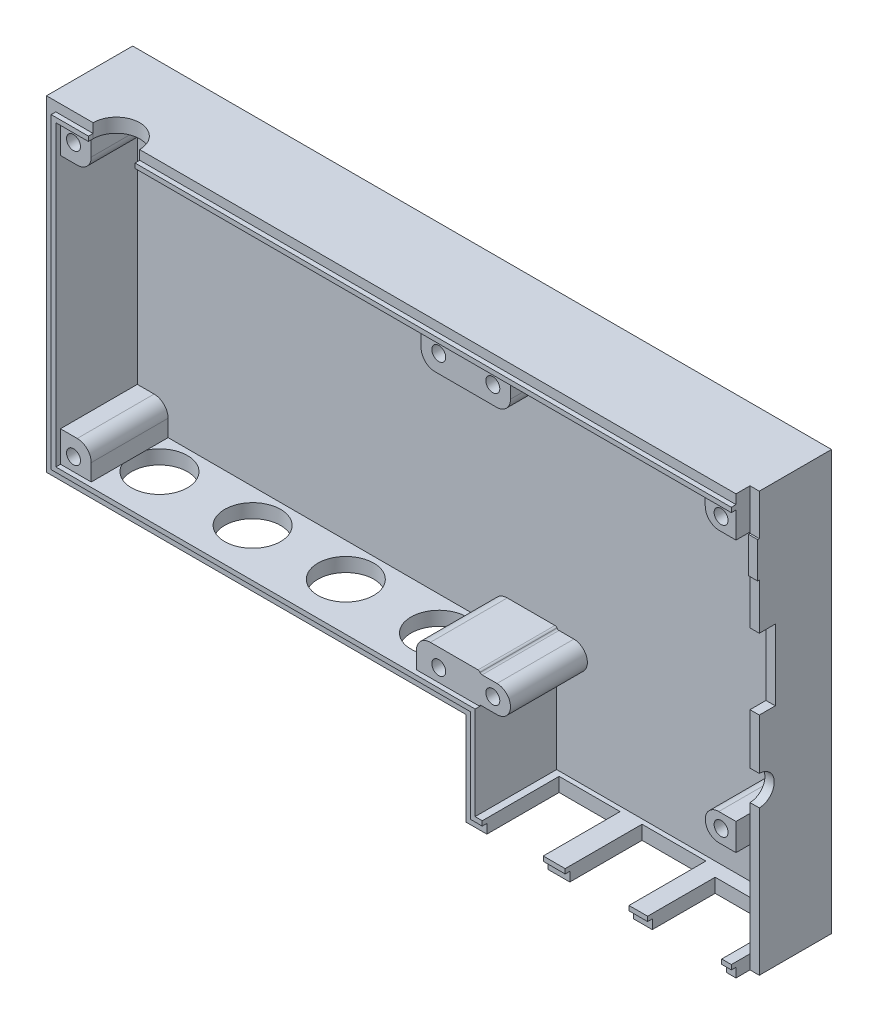
from build123d import *

# Parameters (mm, degrees)
SKETCH1_W                      = 60
SKETCH1_H                      = 90
SKETCH1_R                      = 1.5
BOSS_EXTRUDE1_DEPTH            = 1
BOSS_EXTRUDE2_DEPTH            = 16.5
SKETCH3_W                      = 2
SKETCH3_H                      = 90
BOSS_EXTRUDE3_DEPTH            = 13.5
BOSS_EXTRUDE4_DEPTH            = 1
SKETCH5_W                      = 13.1
SKETCH5_H                      = 3
SKETCH5_W_2                    = 13.7
CUT_EXTRUDE1_DEPTH             = 16.5
SKETCH6_W                      = 15.9
SKETCH6_H                      = 3
CUT_EXTRUDE2_DEPTH             = 14.5
SKETCH7_R                      = 1.5
SKETCH7_W                      = 6.6
SKETCH7_H                      = 6.6
SKETCH7_H_2                    = 5.6
BOSS_EXTRUDE5_DEPTH            = 16.5
FILLET3_R                      = 3
CUT_EXTRUDE3_DEPTH             = 78.24797732
CUT_EXTRUDE3_DEPTH_BACK        = 2
SKETCH10_W                     = 2
SKETCH10_H                     = 15.2
CUT_EXTRUDE4_DEPTH             = 3.43
SKETCH11_W                     = 2
SKETCH11_H                     = 7.7
BOSS_EXTRUDE6_DEPTH            = 0.35
SKETCH13_W                     = 90
SKETCH13_H                     = 70
BOSS_EXTRUDE7_DEPTH            = 2
SKETCH14_W                     = 90
SKETCH14_H                     = 70
SKETCH14_W_2                   = 84
SKETCH14_H_2                   = 64
BOSS_EXTRUDE8_DEPTH            = 16.5
SKETCH15_W                     = 86
SKETCH15_H                     = 66
SKETCH15_W_2                   = 84
SKETCH15_H_2                   = 64
SKETCH15_W_3                   = 4
SKETCH15_H_3                   = 1
BOSS_EXTRUDE9_DEPTH            = 1
SKETCH16_W                     = 6
SKETCH16_H                     = 64
CUT_EXTRUDE6_DEPTH             = 1
CUT_EXTRUDE7_REACH             = 142.151
SKETCH17_R                     = 6
CUT_EXTRUDE7_DIRECTION_2_DEPTH = 141.150811628
BOSS_EXTRUDE10_DEPTH           = 16.5
CUT_EXTRUDE8_DEPTH             = 56
CUT_EXTRUDE8_DEPTH_BACK        = 19
SKETCH18_R                     = 1.5
SKETCH20_W                     = 6
SKETCH20_H                     = 50.8
CUT_EXTRUDE9_DEPTH             = 16.5
FILLET4_R                      = 0.5
FILLET5_R                      = 0.5
CUT_EXTRUDE10_DEPTH            = 4


with BuildPart() as part:
    # Sketch1 → Boss-Extrude1 (new, symmetric)
    with BuildSketch(Plane.XY):
        Rectangle(SKETCH1_W, SKETCH1_H)
        with Locations((-24.2, -18.8)):
            Circle(SKETCH1_R, mode=Mode.SUBTRACT)
        with Locations((-24.2, 39.2)):
            Circle(SKETCH1_R, mode=Mode.SUBTRACT)
        with Locations((24.8, 39.2)):
            Circle(SKETCH1_R, mode=Mode.SUBTRACT)
        with Locations((24.8, -18.8)):
            Circle(SKETCH1_R, mode=Mode.SUBTRACT)
    extrude(amount=BOSS_EXTRUDE1_DEPTH, both=True)

    # Sketch2 → Boss-Extrude2 (add)
    with BuildSketch(Plane.XY.offset(1)):
        Polygon((-27, 42), (28, 42), (28, 45), (-30, 45), (-30, -45), (28, -45), (28, -42), (-27, -42), align=None)
    extrude(amount=BOSS_EXTRUDE2_DEPTH)

    # Sketch3 → Boss-Extrude3 (add)
    with BuildSketch(Plane.XY.offset(1)):
        with Locations((29, 0)):
            Rectangle(SKETCH3_W, SKETCH3_H)
    extrude(amount=BOSS_EXTRUDE3_DEPTH)

    # Sketch4 → Boss-Extrude4 (add)
    with BuildSketch(Plane.XY.offset(17.5)):
        Polygon((28, -43), (-28, -43), (-28, 43), (28, 43), (28, 42), (-27, 42), (-27, -42), (28, -42), align=None)
    extrude(amount=BOSS_EXTRUDE4_DEPTH)

    # Sketch5 → Cut-Extrude1 (cut)
    with BuildSketch(Plane.XY.offset(18.5)):
        with Locations((-18.92, -43.5)):
            Rectangle(SKETCH5_W, SKETCH5_H)
        with Locations((-0.82, -43.5)):
            Rectangle(SKETCH5_W_2, SKETCH5_H)
    extrude(amount=-CUT_EXTRUDE1_DEPTH, mode=Mode.SUBTRACT)

    # Sketch6 → Cut-Extrude2 (cut)
    with BuildSketch(Plane.XY.offset(18.5)):
        with Locations((17.98, -43.5)):
            Rectangle(SKETCH6_W, SKETCH6_H)
    extrude(amount=-CUT_EXTRUDE2_DEPTH, mode=Mode.SUBTRACT)

    # Sketch7 → Boss-Extrude5 (add)
    # profile 1 of 4: a face of its own
    with BuildSketch(Plane.XY.offset(1)):
        with BuildLine():
            Line((-27, -15.9), (-23.3, -15.9))
            ThreePointArc((-23.3, -15.9), (-20.4, -18.8), (-23.3, -21.7))
            Line((-23.3, -21.7), (-27, -21.7))
            Line((-27, -21.7), (-27, -15.9))
        make_face()
        with Locations((-24.2, -18.8)):
            Circle(SKETCH7_R, mode=Mode.SUBTRACT)
    # profile 2 of 4: a face of its own
    with BuildSketch(Plane.XY.offset(1)):
        with Locations((-23.7, 38.7)):
            Rectangle(SKETCH7_W, SKETCH7_H)
        with Locations((-24.2, 39.2)):
            Circle(SKETCH7_R, mode=Mode.SUBTRACT)
    # profile 3 of 4: a face of its own
    with BuildSketch(Plane.XY.offset(1)):
        with BuildLine():
            Line((24.3, -21.7), (28, -21.7))
            Line((28, -21.7), (28, -15.9))
            Line((28, -15.9), (24.3, -15.9))
            ThreePointArc((24.3, -15.9), (21.4, -18.8), (24.3, -21.7))
        make_face()
        with Locations((24.8, -18.8)):
            Circle(SKETCH7_R, mode=Mode.SUBTRACT)
    # profile 4 of 4: a face of its own
    with BuildSketch(Plane.XY.offset(1)):
        with Locations((24.7, 39.2)):
            Rectangle(SKETCH7_W, SKETCH7_H_2)
        with Locations((24.8, 39.2)):
            Circle(SKETCH7_R, mode=Mode.SUBTRACT)
    extrude(amount=BOSS_EXTRUDE5_DEPTH)

    # Fillet3
    fillet3_edges = [part.edges().sort_by_distance(p)[0] for p in [
        (-20.4, 35.4, 9.25),
        (21.4, 36.4, 9.25),
    ]]
    fillet(fillet3_edges, radius=FILLET3_R)

    # Sketch9 → Cut-Extrude3 (cut, two sides: drawn at the far end of the back side and taken through both)
    with BuildSketch(Plane(origin=(30, 0, 0), x_dir=(0, 0, -1), z_dir=(1, 0, 0)).offset(-CUT_EXTRUDE3_DEPTH_BACK)):
        with BuildLine():
            Line((-146.271990211, -13.88), (-14.5, -13.88))
            ThreePointArc((-14.5, -13.88), (-11.3, -10.68), (-14.5, -7.48))
            Line((-14.5, -7.48), (-146.271990211, -7.48))
            Line((-146.271990211, -7.48), (-409.815970634, -7.48))
            Line((-409.815970634, -7.48), (-409.815970634, -13.88))
            Line((-409.815970634, -13.88), (-146.271990211, -13.88))
        make_face()
    extrude(amount=CUT_EXTRUDE3_DEPTH + CUT_EXTRUDE3_DEPTH_BACK, mode=Mode.SUBTRACT)

    # Sketch10 → Cut-Extrude4 (cut)
    with BuildSketch(Plane.XY.offset(14.5)):
        with Locations((29, 10.98)):
            Rectangle(SKETCH10_W, SKETCH10_H)
    extrude(amount=-CUT_EXTRUDE4_DEPTH, mode=Mode.SUBTRACT)

    # Sketch11 → Boss-Extrude6 (add)
    with BuildSketch(Plane.XY.offset(14.5)):
        with Locations((29, 32.32)):
            Rectangle(SKETCH11_W, SKETCH11_H)
    extrude(amount=BOSS_EXTRUDE6_DEPTH)

    # Sketch13 → Boss-Extrude7 (add)
    with BuildSketch(Plane(origin=(0, 0, -1), x_dir=(-1, 0, 0), z_dir=(0, 0, -1))):
        with Locations((75, 10)):
            Rectangle(SKETCH13_W, SKETCH13_H)
    extrude(amount=-BOSS_EXTRUDE7_DEPTH)

    # Sketch14 → Boss-Extrude8 (add)
    with BuildSketch(Plane.XY.offset(1)):
        with Locations((-75, 10)):
            Rectangle(SKETCH14_W, SKETCH14_H)
        with Locations((-75, 10)):
            Rectangle(SKETCH14_W_2, SKETCH14_H_2, mode=Mode.SUBTRACT)
    extrude(amount=BOSS_EXTRUDE8_DEPTH)

    # Sketch15 → Boss-Extrude9 (add)
    # profile 1 of 3: a face of its own
    with BuildSketch(Plane.XY.offset(17.5)):
        with Locations((-75, 10)):
            Rectangle(SKETCH15_W, SKETCH15_H)
        with Locations((-75, 10)):
            Rectangle(SKETCH15_W_2, SKETCH15_H_2, mode=Mode.SUBTRACT)
    # profile 2 of 3: a face of its own
    with BuildSketch(Plane.XY.offset(17.5)):
        with Locations((-30, -22.5)):
            Rectangle(SKETCH15_W_3, SKETCH15_H_3)
    # profile 3 of 3: a face of its own
    with BuildSketch(Plane.XY.offset(17.5)):
        with Locations((-30, 42.5)):
            Rectangle(SKETCH15_W_3, SKETCH15_H_3)
    extrude(amount=BOSS_EXTRUDE9_DEPTH)

    # Sketch16 → Cut-Extrude6 (cut)
    with BuildSketch(Plane.XY.offset(18.5)):
        with Locations((-30, 10)):
            Rectangle(SKETCH16_W, SKETCH16_H)
    extrude(amount=-CUT_EXTRUDE6_DEPTH, mode=Mode.SUBTRACT)

    # Sketch17 → Cut-Extrude7 (cut, up to next)
    with BuildSketch(Plane.XZ.offset(25), mode=Mode.PRIVATE) as cut_extrude7_sk1:
        with Locations(Location((-45, 8.25, 0), (0, 0, 90))):
            Circle(SKETCH17_R)
    cut_extrude7_tool1 = extrude(cut_extrude7_sk1.sketch, amount=-CUT_EXTRUDE7_REACH, mode=Mode.PRIVATE) & part.part
    # Sketch17 → Cut-Extrude7 (cut, up to next)
    with BuildSketch(Plane.XZ.offset(25), mode=Mode.PRIVATE) as cut_extrude7_sk2:
        with Locations(Location((-65, 8.25, 0), (0, 0, 90))):
            Circle(SKETCH17_R)
    cut_extrude7_tool2 = extrude(cut_extrude7_sk2.sketch, amount=-CUT_EXTRUDE7_REACH, mode=Mode.PRIVATE) & part.part
    # Sketch17 → Cut-Extrude7 (cut, up to next)
    with BuildSketch(Plane.XZ.offset(25), mode=Mode.PRIVATE) as cut_extrude7_sk3:
        with Locations(Location((-85, 8.25, 0), (0, 0, 90))):
            Circle(SKETCH17_R)
    cut_extrude7_tool3 = extrude(cut_extrude7_sk3.sketch, amount=-CUT_EXTRUDE7_REACH, mode=Mode.PRIVATE) & part.part
    # Sketch17 → Cut-Extrude7 (cut, up to next)
    with BuildSketch(Plane.XZ.offset(25), mode=Mode.PRIVATE) as cut_extrude7_sk4:
        with Locations(Location((-105, 8.25, 0), (0, 0, 90))):
            Circle(SKETCH17_R)
    cut_extrude7_tool4 = extrude(cut_extrude7_sk4.sketch, amount=-CUT_EXTRUDE7_REACH, mode=Mode.PRIVATE) & part.part
    add(cut_extrude7_tool1.solids().sort_by_distance((-45, -25, 8.25))[0], mode=Mode.SUBTRACT)
    add(cut_extrude7_tool2.solids().sort_by_distance((-65, -25, 8.25))[0], mode=Mode.SUBTRACT)
    add(cut_extrude7_tool3.solids().sort_by_distance((-85, -25, 8.25))[0], mode=Mode.SUBTRACT)
    add(cut_extrude7_tool4.solids().sort_by_distance((-105, -25, 8.25))[0], mode=Mode.SUBTRACT)

    # Sketch17 → Cut-Extrude7 direction 2 (cut)
    with BuildSketch(Plane.XZ.offset(25)):
        with Locations(Location((-45, 8.25, 0), (0, 0, 90))):
            Circle(SKETCH17_R)
        with Locations(Location((-65, 8.25, 0), (0, 0, 90))):
            Circle(SKETCH17_R)
        with Locations(Location((-85, 8.25, 0), (0, 0, 90))):
            Circle(SKETCH17_R)
        with Locations(Location((-105, 8.25, 0), (0, 0, 90))):
            Circle(SKETCH17_R)
    extrude(amount=CUT_EXTRUDE7_DIRECTION_2_DEPTH, mode=Mode.SUBTRACT)

    # Sketch19 → Boss-Extrude10 (add)
    with BuildSketch(Plane.XY.offset(1)):
        with BuildLine():
            Line((-117, -15.400002114), (-113.400002114, -15.400002114))
            ThreePointArc((-113.400002114, -15.400002114), (-111.27868177, -16.27868177), (-110.400002114, -18.400002114))
            Line((-110.400002114, -18.400002114), (-110.400002114, -22))
            Line((-110.400002114, -22), (-117, -22))
            Line((-117, -22), (-117, -15.400002114))
        make_face()
        with BuildLine():
            Line((-40.6, -22), (-40.6, -18.4))
            ThreePointArc((-40.6, -18.4), (-39.721320344, -16.278679656), (-37.6, -15.4))
            Line((-37.6, -15.4), (-33, -15.4))
            Line((-33, -15.4), (-33, -22))
            Line((-33, -22), (-40.6, -22))
        make_face()
        with BuildLine():
            Line((-39.6, 42), (-39.6, 38.4))
            ThreePointArc((-39.6, 38.4), (-38.721320344, 36.278679656), (-36.6, 35.4))
            Line((-36.6, 35.4), (-33, 35.4))
            Line((-33, 35.4), (-33, 42))
            Line((-33, 42), (-39.6, 42))
        make_face()
        with BuildLine():
            Line((-110.4, 42), (-110.4, 38.4))
            ThreePointArc((-110.4, 38.4), (-111.278679656, 36.278679656), (-113.4, 35.4))
            Line((-113.4, 35.4), (-117, 35.4))
            Line((-117, 35.4), (-117, 42))
            Line((-117, 42), (-110.4, 42))
        make_face()
    extrude(amount=BOSS_EXTRUDE10_DEPTH)

    # Sketch18 → Cut-Extrude8 (cut, two sides: drawn at the far end of the back side and taken through both)
    with BuildSketch(Plane.XY.offset(1).offset(-CUT_EXTRUDE8_DEPTH_BACK)):
        with Locations((-114.2, 39.2)):
            Circle(SKETCH18_R)
        with Locations((-35.8, 39.2)):
            Circle(SKETCH18_R)
        with Locations((-35.8, -19.2)):
            Circle(SKETCH18_R)
        with Locations((-114.2, -19.2)):
            Circle(SKETCH18_R)
    extrude(amount=CUT_EXTRUDE8_DEPTH + CUT_EXTRUDE8_DEPTH_BACK, mode=Mode.SUBTRACT)

    # Sketch20 → Cut-Extrude9 (cut)
    with BuildSketch(Plane.XY.offset(17.5)):
        with Locations((-30, 10)):
            Rectangle(SKETCH20_W, SKETCH20_H)
    extrude(amount=-CUT_EXTRUDE9_DEPTH, mode=Mode.SUBTRACT)

    # Fillet4
    fillet4_edges = [part.edges().sort_by_distance(p)[0] for p in [
        (-27, -15.9, 9.25),
    ]]
    fillet(fillet4_edges, radius=FILLET4_R - 0.0001)  # a hair under: the kernel refuses the full size

    # Fillet5
    fillet5_edges = [part.edges().sort_by_distance(p)[0] for p in [
        (-27, -15.4, 9.25),
    ]]
    fillet(fillet5_edges, radius=FILLET5_R)

    # Sketch21 → Cut-Extrude10 (cut)
    with BuildSketch(Plane(origin=(0, 45, 0), x_dir=(1, 0, 0), z_dir=(0, 1, 0))):
        with BuildLine():
            Line((-110, -17.5), (-110, -18.5))
            Line((-110, -18.5), (-100, -18.5))
            Line((-100, -18.5), (-100, -17.5))
            ThreePointArc((-100, -17.5), (-105, -12.5), (-110, -17.5))
        make_face()
    extrude(amount=-CUT_EXTRUDE10_DEPTH, mode=Mode.SUBTRACT)


solid = part.part
